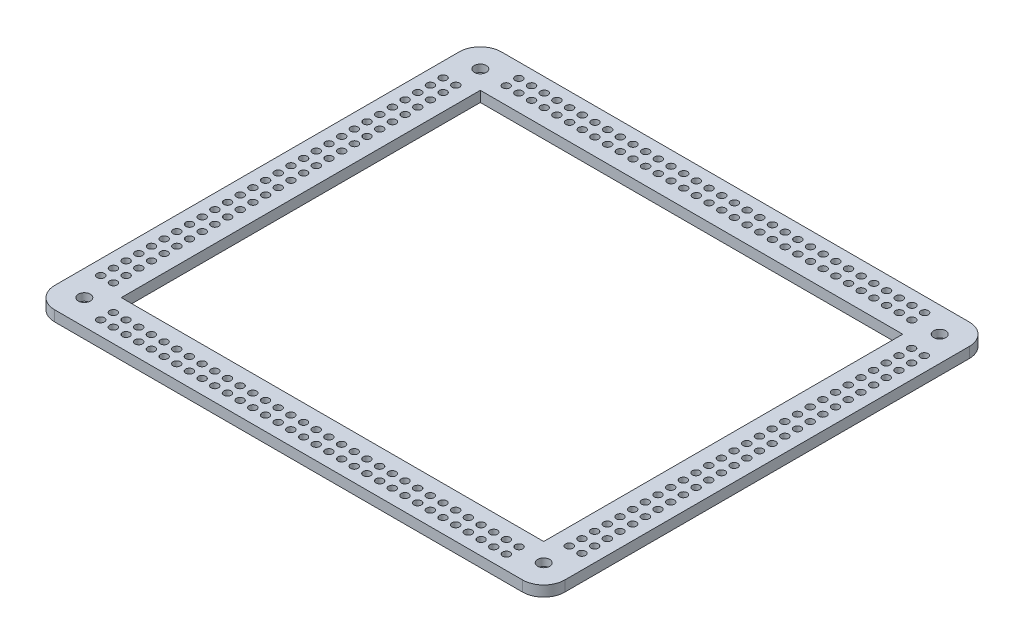
from build123d import *

# Parameters (mm, degrees)
SKETCH1_W               = 241.4
SKETCH1_H               = 211.4
SKETCH1_W_2             = 199.9
SKETCH1_H_2             = 169.9
BOSS_EXTRUDE1_DEPTH     = 5
FILLET1_R               = 10
SKETCH2_R               = 5.85
BOSS_EXTRUDE2_DEPTH     = 2.5
SKETCH3_R               = 1.55
CUT_EXTRUDE1_DEPTH      = 7.5
SKETCH4_R               = 2.85
CUT_EXTRUDE2_DEPTH      = 3.5
MIRROR4_COPY_1_SKETCH_R = 5.85
MIRROR4_COPY_1_DEPTH    = 2.5
MIRROR4_COPY_2_SKETCH_R = 1.55
MIRROR4_COPY_2_DEPTH    = 7.5
MIRROR4_COPY_3_SKETCH_R = 2.85
MIRROR4_COPY_3_DEPTH    = 3.5
MIRROR4_COPY_4_SKETCH_R = 5.85
MIRROR4_COPY_4_DEPTH    = 2.5
MIRROR4_COPY_5_SKETCH_R = 1.55
MIRROR4_COPY_5_DEPTH    = 7.5
MIRROR4_COPY_6_SKETCH_R = 2.85
MIRROR4_COPY_6_DEPTH    = 3.5
SKETCH5_R               = 1.75
CUT_EXTRUDE3_DEPTH      = 5
SKETCH6_R               = 1.75
CUT_EXTRUDE4_DEPTH      = 5


with BuildPart() as part:
    # Sketch1 → Boss-Extrude1 (new body)
    with BuildSketch(Plane(origin=(0, 0, 0), x_dir=(1, 0, 0), z_dir=(0, 1, 0))):
        Rectangle(SKETCH1_W, SKETCH1_H)
        Rectangle(SKETCH1_W_2, SKETCH1_H_2, mode=Mode.SUBTRACT)
    extrude(amount=BOSS_EXTRUDE1_DEPTH)

    # Fillet1
    fillet1_edges = [part.edges().sort_by_distance(p)[0] for p in [
        (-120.7, 2.5, -105.7),
        (120.7, 2.5, -105.7),
        (120.7, 2.5, 105.7),
        (-120.7, 2.5, 105.7),
    ]]
    fillet(fillet1_edges, radius=FILLET1_R)

    # Sketch2 → Boss-Extrude2 (add)
    with BuildSketch(Plane.XZ):
        with Locations((-108.7, 93.7)):
            Circle(SKETCH2_R)
    boss_extrude2 = extrude(amount=BOSS_EXTRUDE2_DEPTH)

    # Sketch3 → Cut-Extrude1 (cut)
    with BuildSketch(Plane(origin=(0, 5, 0), x_dir=(1, 0, 0), z_dir=(0, 1, 0))):
        with Locations((-108.7, -93.7)):
            Circle(SKETCH3_R)
    cut_extrude1 = extrude(amount=-CUT_EXTRUDE1_DEPTH, mode=Mode.SUBTRACT)

    # Sketch4 → Cut-Extrude2 (cut)
    with BuildSketch(Plane(origin=(0, 5, 0), x_dir=(1, 0, 0), z_dir=(0, 1, 0))):
        with Locations((-108.7, -93.7)):
            Circle(SKETCH4_R)
    cut_extrude2 = extrude(amount=-CUT_EXTRUDE2_DEPTH, mode=Mode.SUBTRACT)

    # Mirror3: Boss-Extrude2, Cut-Extrude1, Cut-Extrude2 across plane
    add(boss_extrude2.mirror(Plane(origin=(0, 0, 0), x_dir=(0, 0, 1), z_dir=(1, 0, 0))))
    add(cut_extrude1.mirror(Plane(origin=(0, 0, 0), x_dir=(0, 0, 1), z_dir=(1, 0, 0))), mode=Mode.SUBTRACT)
    add(cut_extrude2.mirror(Plane(origin=(0, 0, 0), x_dir=(0, 0, 1), z_dir=(1, 0, 0))), mode=Mode.SUBTRACT)

    # Mirror4 copy 1 sketch → Mirror4 copy 1 (add)
    with BuildSketch(Plane(origin=(0, 0, 0), x_dir=(-1, 0, 0), z_dir=(0, -1, 0))):
        with Locations((-108.7, 93.7)):
            Circle(MIRROR4_COPY_1_SKETCH_R)
    extrude(amount=MIRROR4_COPY_1_DEPTH)

    # Mirror4 copy 2 sketch → Mirror4 copy 2 (cut)
    with BuildSketch(Plane(origin=(0, 5, 0), x_dir=(-1, 0, 0), z_dir=(0, 1, 0))):
        with Locations((-108.7, -93.7)):
            Circle(MIRROR4_COPY_2_SKETCH_R)
    extrude(amount=-MIRROR4_COPY_2_DEPTH, mode=Mode.SUBTRACT)

    # Mirror4 copy 3 sketch → Mirror4 copy 3 (cut)
    with BuildSketch(Plane(origin=(0, 5, 0), x_dir=(-1, 0, 0), z_dir=(0, 1, 0))):
        with Locations((-108.7, -93.7)):
            Circle(MIRROR4_COPY_3_SKETCH_R)
    extrude(amount=-MIRROR4_COPY_3_DEPTH, mode=Mode.SUBTRACT)

    # Mirror4 copy 4 sketch → Mirror4 copy 4 (add)
    with BuildSketch(Plane.XZ):
        with Locations((-108.7, -93.7)):
            Circle(MIRROR4_COPY_4_SKETCH_R)
    extrude(amount=MIRROR4_COPY_4_DEPTH)

    # Mirror4 copy 5 sketch → Mirror4 copy 5 (cut)
    with BuildSketch(Plane(origin=(0, 5, 0), x_dir=(1, 0, 0), z_dir=(0, 1, 0))):
        with Locations((-108.7, 93.7)):
            Circle(MIRROR4_COPY_5_SKETCH_R)
    extrude(amount=-MIRROR4_COPY_5_DEPTH, mode=Mode.SUBTRACT)

    # Mirror4 copy 6 sketch → Mirror4 copy 6 (cut)
    with BuildSketch(Plane(origin=(0, 5, 0), x_dir=(1, 0, 0), z_dir=(0, 1, 0))):
        with Locations((-108.7, 93.7)):
            Circle(MIRROR4_COPY_6_SKETCH_R)
    extrude(amount=-MIRROR4_COPY_6_DEPTH, mode=Mode.SUBTRACT)

    # Sketch5 → Cut-Extrude3 (cut)
    with BuildSketch(Plane(origin=(0, 5, 0), x_dir=(1, 0, 0), z_dir=(0, 1, 0))):
        with Locations((-95.7, -92.95)):
            Circle(SKETCH5_R)
        with Locations((-95.7, -98.95)):
            Circle(SKETCH5_R)
        with Locations((-89.7, -92.95)):
            Circle(SKETCH5_R)
        with Locations((-89.7, -98.95)):
            Circle(SKETCH5_R)
        with Locations((-83.7, -92.95)):
            Circle(SKETCH5_R)
        with Locations((-83.7, -98.95)):
            Circle(SKETCH5_R)
        with Locations((-77.7, -92.95)):
            Circle(SKETCH5_R)
        with Locations((-77.7, -98.95)):
            Circle(SKETCH5_R)
        with Locations((-71.7, -92.95)):
            Circle(SKETCH5_R)
        with Locations((-71.7, -98.95)):
            Circle(SKETCH5_R)
        with Locations((-65.7, -92.95)):
            Circle(SKETCH5_R)
        with Locations((-65.7, -98.95)):
            Circle(SKETCH5_R)
        with Locations((-59.7, -92.95)):
            Circle(SKETCH5_R)
        with Locations((-59.7, -98.95)):
            Circle(SKETCH5_R)
        with Locations((-53.7, -92.95)):
            Circle(SKETCH5_R)
        with Locations((-53.7, -98.95)):
            Circle(SKETCH5_R)
        with Locations((-47.7, -92.95)):
            Circle(SKETCH5_R)
        with Locations((-47.7, -98.95)):
            Circle(SKETCH5_R)
        with Locations((-41.7, -92.95)):
            Circle(SKETCH5_R)
        with Locations((-41.7, -98.95)):
            Circle(SKETCH5_R)
        with Locations((-35.7, -92.95)):
            Circle(SKETCH5_R)
        with Locations((-35.7, -98.95)):
            Circle(SKETCH5_R)
        with Locations((-29.7, -92.95)):
            Circle(SKETCH5_R)
        with Locations((-29.7, -98.95)):
            Circle(SKETCH5_R)
        with Locations((-23.7, -92.95)):
            Circle(SKETCH5_R)
        with Locations((-23.7, -98.95)):
            Circle(SKETCH5_R)
        with Locations((-17.7, -92.95)):
            Circle(SKETCH5_R)
        with Locations((-17.7, -98.95)):
            Circle(SKETCH5_R)
        with Locations((-11.7, -92.95)):
            Circle(SKETCH5_R)
        with Locations((-11.7, -98.95)):
            Circle(SKETCH5_R)
        with Locations((-5.7, -92.95)):
            Circle(SKETCH5_R)
        with Locations((-5.7, -98.95)):
            Circle(SKETCH5_R)
        with Locations((0.3, -92.95)):
            Circle(SKETCH5_R)
        with Locations((0.3, -98.95)):
            Circle(SKETCH5_R)
        with Locations((6.3, -92.95)):
            Circle(SKETCH5_R)
        with Locations((6.3, -98.95)):
            Circle(SKETCH5_R)
        with Locations((12.3, -92.95)):
            Circle(SKETCH5_R)
        with Locations((12.3, -98.95)):
            Circle(SKETCH5_R)
        with Locations((18.3, -92.95)):
            Circle(SKETCH5_R)
        with Locations((18.3, -98.95)):
            Circle(SKETCH5_R)
        with Locations((24.3, -92.95)):
            Circle(SKETCH5_R)
        with Locations((24.3, -98.95)):
            Circle(SKETCH5_R)
        with Locations((30.3, -92.95)):
            Circle(SKETCH5_R)
        with Locations((30.3, -98.95)):
            Circle(SKETCH5_R)
        with Locations((36.3, -92.95)):
            Circle(SKETCH5_R)
        with Locations((36.3, -98.95)):
            Circle(SKETCH5_R)
        with Locations((42.3, -92.95)):
            Circle(SKETCH5_R)
        with Locations((42.3, -98.95)):
            Circle(SKETCH5_R)
        with Locations((48.3, -92.95)):
            Circle(SKETCH5_R)
        with Locations((48.3, -98.95)):
            Circle(SKETCH5_R)
        with Locations((54.3, -92.95)):
            Circle(SKETCH5_R)
        with Locations((54.3, -98.95)):
            Circle(SKETCH5_R)
        with Locations((60.3, -92.95)):
            Circle(SKETCH5_R)
        with Locations((60.3, -98.95)):
            Circle(SKETCH5_R)
        with Locations((66.3, -92.95)):
            Circle(SKETCH5_R)
        with Locations((66.3, -98.95)):
            Circle(SKETCH5_R)
        with Locations((72.3, -92.95)):
            Circle(SKETCH5_R)
        with Locations((72.3, -98.95)):
            Circle(SKETCH5_R)
        with Locations((78.3, -92.95)):
            Circle(SKETCH5_R)
        with Locations((78.3, -98.95)):
            Circle(SKETCH5_R)
        with Locations((84.3, -92.95)):
            Circle(SKETCH5_R)
        with Locations((84.3, -98.95)):
            Circle(SKETCH5_R)
        with Locations((90.3, -92.95)):
            Circle(SKETCH5_R)
        with Locations((90.3, -98.95)):
            Circle(SKETCH5_R)
        with Locations((96.3, -92.95)):
            Circle(SKETCH5_R)
        with Locations((96.3, -98.95)):
            Circle(SKETCH5_R)
    cut_extrude3 = extrude(amount=-CUT_EXTRUDE3_DEPTH, mode=Mode.SUBTRACT)

    # Mirror5: Cut-Extrude3 across plane
    add(cut_extrude3.mirror(Plane.XY), mode=Mode.SUBTRACT)

    # Sketch6 → Cut-Extrude4 (cut)
    with BuildSketch(Plane(origin=(0, 5, 0), x_dir=(1, 0, 0), z_dir=(0, 1, 0))):
        with Locations((-107.85, -80.75)):
            Circle(SKETCH6_R)
        with Locations((-113.85, -80.75)):
            Circle(SKETCH6_R)
        with Locations((-107.85, -74.75)):
            Circle(SKETCH6_R)
        with Locations((-113.85, -74.75)):
            Circle(SKETCH6_R)
        with Locations((-107.85, -68.75)):
            Circle(SKETCH6_R)
        with Locations((-113.85, -68.75)):
            Circle(SKETCH6_R)
        with Locations((-107.85, -62.75)):
            Circle(SKETCH6_R)
        with Locations((-113.85, -62.75)):
            Circle(SKETCH6_R)
        with Locations((-107.85, -56.75)):
            Circle(SKETCH6_R)
        with Locations((-113.85, -56.75)):
            Circle(SKETCH6_R)
        with Locations((-107.85, -50.75)):
            Circle(SKETCH6_R)
        with Locations((-113.85, -50.75)):
            Circle(SKETCH6_R)
        with Locations((-107.85, -44.75)):
            Circle(SKETCH6_R)
        with Locations((-113.85, -44.75)):
            Circle(SKETCH6_R)
        with Locations((-107.85, -38.75)):
            Circle(SKETCH6_R)
        with Locations((-113.85, -38.75)):
            Circle(SKETCH6_R)
        with Locations((-107.85, -32.75)):
            Circle(SKETCH6_R)
        with Locations((-113.85, -32.75)):
            Circle(SKETCH6_R)
        with Locations((-107.85, -26.75)):
            Circle(SKETCH6_R)
        with Locations((-113.85, -26.75)):
            Circle(SKETCH6_R)
        with Locations((-107.85, -20.75)):
            Circle(SKETCH6_R)
        with Locations((-113.85, -20.75)):
            Circle(SKETCH6_R)
        with Locations((-107.85, -14.75)):
            Circle(SKETCH6_R)
        with Locations((-113.85, -14.75)):
            Circle(SKETCH6_R)
        with Locations((-107.85, -8.75)):
            Circle(SKETCH6_R)
        with Locations((-113.85, -8.75)):
            Circle(SKETCH6_R)
        with Locations((-107.85, -2.75)):
            Circle(SKETCH6_R)
        with Locations((-113.85, -2.75)):
            Circle(SKETCH6_R)
        with Locations((-107.85, 3.25)):
            Circle(SKETCH6_R)
        with Locations((-113.85, 3.25)):
            Circle(SKETCH6_R)
        with Locations((-107.85, 9.25)):
            Circle(SKETCH6_R)
        with Locations((-113.85, 9.25)):
            Circle(SKETCH6_R)
        with Locations((-107.85, 15.25)):
            Circle(SKETCH6_R)
        with Locations((-113.85, 15.25)):
            Circle(SKETCH6_R)
        with Locations((-107.85, 21.25)):
            Circle(SKETCH6_R)
        with Locations((-113.85, 21.25)):
            Circle(SKETCH6_R)
        with Locations((-107.85, 27.25)):
            Circle(SKETCH6_R)
        with Locations((-113.85, 27.25)):
            Circle(SKETCH6_R)
        with Locations((-107.85, 33.25)):
            Circle(SKETCH6_R)
        with Locations((-113.85, 33.25)):
            Circle(SKETCH6_R)
        with Locations((-107.85, 39.25)):
            Circle(SKETCH6_R)
        with Locations((-113.85, 39.25)):
            Circle(SKETCH6_R)
        with Locations((-107.85, 45.25)):
            Circle(SKETCH6_R)
        with Locations((-113.85, 45.25)):
            Circle(SKETCH6_R)
        with Locations((-107.85, 51.25)):
            Circle(SKETCH6_R)
        with Locations((-113.85, 51.25)):
            Circle(SKETCH6_R)
        with Locations((-107.85, 57.25)):
            Circle(SKETCH6_R)
        with Locations((-113.85, 57.25)):
            Circle(SKETCH6_R)
        with Locations((-107.85, 63.25)):
            Circle(SKETCH6_R)
        with Locations((-113.85, 63.25)):
            Circle(SKETCH6_R)
        with Locations((-107.85, 69.25)):
            Circle(SKETCH6_R)
        with Locations((-113.85, 69.25)):
            Circle(SKETCH6_R)
        with Locations((-107.85, 75.25)):
            Circle(SKETCH6_R)
        with Locations((-113.85, 75.25)):
            Circle(SKETCH6_R)
        with Locations((-107.85, 81.25)):
            Circle(SKETCH6_R)
        with Locations((-113.85, 81.25)):
            Circle(SKETCH6_R)
    cut_extrude4 = extrude(amount=-CUT_EXTRUDE4_DEPTH, mode=Mode.SUBTRACT)

    # Mirror6: Cut-Extrude4 across plane
    add(cut_extrude4.mirror(Plane(origin=(0, 0, 0), x_dir=(0, 0, 1), z_dir=(1, 0, 0))), mode=Mode.SUBTRACT)


solid = part.part
